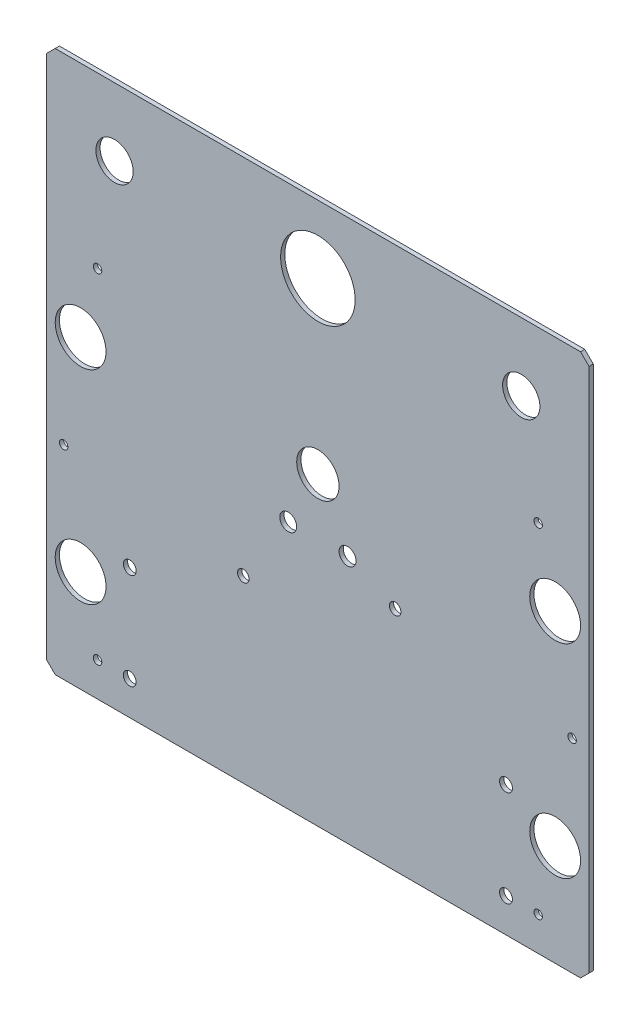
from build123d import *

# Parameters (mm, degrees)
SKETCH1_W           = 203.2
SKETCH1_H           = 203.2
BASE_FLANGE1_DEPTH  = 1.5875
SKETCH6_R           = 1.5875
SKETCH6_R_2         = 2.413
SKETCH6_R_3         = 9.525
CUT_EXTRUDE1_DEPTH  = 288.372580731
BREAK_CORNER1_START = -1.5875
BREAK_CORNER1_DEPTH = 1.5875
SKETCH7_R           = 6.985
SKETCH7_R_2         = 13.97
SKETCH7_R_3         = 7.9375
SKETCH7_R_4         = 3.175
SKETCH7_R_5         = 2.159
CUT_EXTRUDE2_DEPTH  = 288.372580731


# Read off the part's stored shape, not the designer's step: Break-Corner1
# Sheet-metal steps are written as plain solids
with BuildPart() as part:
    # Sketch1 → Base-Flange1 (new body)
    with BuildSketch(Plane.XY):
        with Locations((101.6, 101.6)):
            Rectangle(SKETCH1_W, SKETCH1_H)
    extrude(amount=-BASE_FLANGE1_DEPTH)

    # Sketch6 → Cut-Extrude1 (cut, through all)
    with BuildSketch(Plane(origin=(0, 0, -1.5875), x_dir=(-1, 0, 0), z_dir=(0, 0, -1))):
        with Locations((-19.05, 139.7)):
            Circle(SKETCH6_R)
        with Locations((-19.05, 12.7)):
            Circle(SKETCH6_R)
        with Locations((-31.115, 48.768)):
            Circle(SKETCH6_R_2)
        with Locations((-31.115, 12.7)):
            Circle(SKETCH6_R_2)
        with Locations((-172.085, 48.768)):
            Circle(SKETCH6_R_2)
        with Locations((-172.085, 12.7)):
            Circle(SKETCH6_R_2)
        with Locations((-184.15, 139.7)):
            Circle(SKETCH6_R)
        with Locations((-184.15, 12.7)):
            Circle(SKETCH6_R)
        with Locations((-190.5, 38.1)):
            Circle(SKETCH6_R_3)
        with Locations((-190.5, 114.3)):
            Circle(SKETCH6_R_3)
        with Locations((-12.7, 114.3)):
            Circle(SKETCH6_R_3)
        with Locations((-12.7, 38.1)):
            Circle(SKETCH6_R_3)
        with Locations((-6.35, 76.2)):
            Circle(SKETCH6_R)
        with Locations((-196.85, 76.2)):
            Circle(SKETCH6_R)
    extrude(amount=-CUT_EXTRUDE1_DEPTH, mode=Mode.SUBTRACT)

    # Break-Corner1 outline → Break-Corner1 (cut)
    with BuildSketch(Plane.XY.offset(BREAK_CORNER1_START)):
        Polygon((0, 0), (3.175, 0), (0, 3.175), align=None)
        Polygon((203.2, 3.175), (200.025, 0), (203.2, 0), align=None)
        Polygon((0, 203.2), (0, 200.025), (3.175, 203.2), align=None)
        Polygon((200.025, 203.2), (203.2, 200.025), (203.2, 203.2), align=None)
    extrude(amount=BREAK_CORNER1_DEPTH, mode=Mode.SUBTRACT)

    # Sketch7 → Cut-Extrude2 (cut, through all)
    with BuildSketch(Plane(origin=(0, 0, -1.5875), x_dir=(-1, 0, 0), z_dir=(0, 0, -1))):
        with Locations((-177.8, 177.8)):
            Circle(SKETCH7_R)
        with Locations((-101.6, 177.8)):
            Circle(SKETCH7_R_2)
        with Locations((-25.4, 177.8)):
            Circle(SKETCH7_R)
        with Locations((-101.6, 114.3)):
            Circle(SKETCH7_R_3)
        with Locations((-112.7125, 93.218)):
            Circle(SKETCH7_R_4)
        with Locations((-90.4875, 93.218)):
            Circle(SKETCH7_R_4)
        with Locations((-130.556, 85.09)):
            Circle(SKETCH7_R_5)
        with Locations((-73.66, 67.31)):
            Circle(SKETCH7_R_5)
    extrude(amount=-CUT_EXTRUDE2_DEPTH, mode=Mode.SUBTRACT)


solid = part.part
